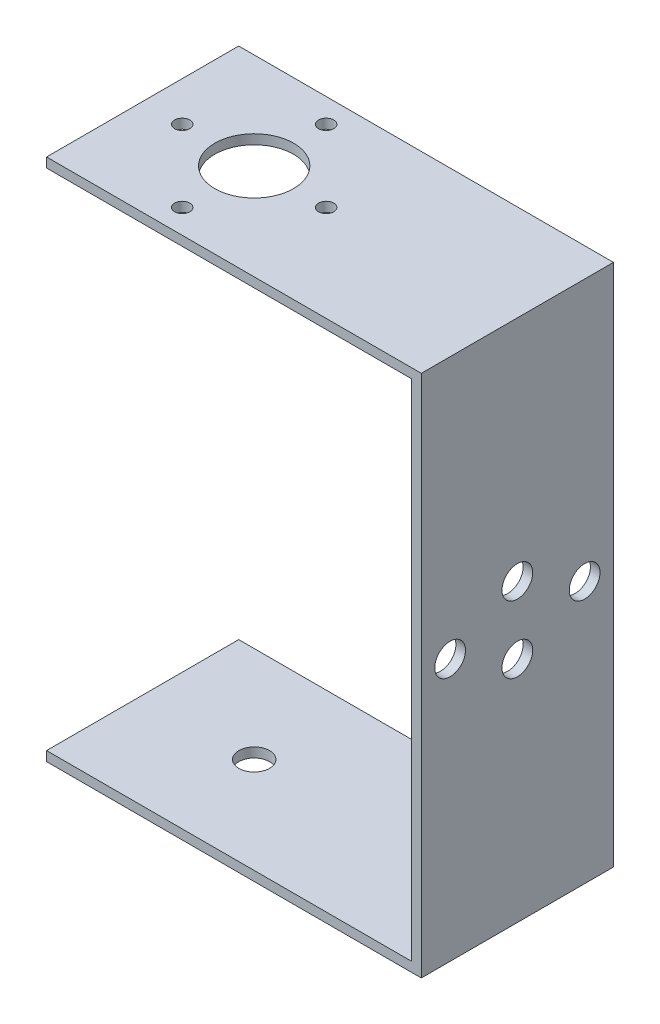
from build123d import *

# Parameters (mm, degrees)
SKETCH_1_W           = 20
SKETCH_1_H           = 54.5
EXTRUDE_1_DEPTH      = 1
SKETCH_2_W           = 20
SKETCH_2_H           = 1
EXTRUDE_2_DEPTH      = 38
SKETCH_3_W           = 20
SKETCH_3_H           = 1
EXTRUDE_3_DEPTH      = 38
SKETCH_4_R           = 4.1
CUT_EXTRUDE_1_DEPTH  = 1
SKETCH_5_R           = 0.79
CUT_EXTRUDE_2_DEPTH  = 1
SKETCH_6_R           = 0.79
CUT_EXTRUDE_3_DEPTH  = 1
SKETCH_7_R           = 0.79
CUT_EXTRUDE_4_DEPTH  = 1
SKETCH_8_R           = 0.79
CUT_EXTRUDE_5_DEPTH  = 1
SKETCH_9_R           = 1.6
CUT_EXTRUDE_6_DEPTH  = 1
CUT_EXTRUDE_7_REACH  = 71.937
SKETCH_10_R          = 1.6
CUT_EXTRUDE_8_REACH  = 71.937
SKETCH_11_R          = 1.6
CUT_EXTRUDE_9_REACH  = 71.937
SKETCH_12_R          = 1.6
CUT_EXTRUDE_10_REACH = 71.937
SKETCH_14_R          = 1.6


with BuildPart() as part:
    # ｽｹｯﾁ1 → ﾎﾞｽ - 押し出し1 (new body)
    with BuildSketch(Plane(origin=(0, 0, 0), x_dir=(0, 0, -1), z_dir=(1, 0, 0))):
        with Locations((10, 27.25)):
            Rectangle(SKETCH_1_W, SKETCH_1_H)
    extrude(amount=EXTRUDE_1_DEPTH)

    # ｽｹｯﾁ2 → ﾎﾞｽ - 押し出し2 (add)
    with BuildSketch(Plane.ZY):
        with Locations((-10, 54)):
            Rectangle(SKETCH_2_W, SKETCH_2_H)
    extrude(amount=EXTRUDE_2_DEPTH)

    # ｽｹｯﾁ3 → ﾎﾞｽ - 押し出し3 (add)
    with BuildSketch(Plane.ZY):
        with Locations((-10, 0.5)):
            Rectangle(SKETCH_3_W, SKETCH_3_H)
    extrude(amount=EXTRUDE_3_DEPTH)

    # ｽｹｯﾁ4 → ｶｯﾄ - 押し出し1 (cut)
    with BuildSketch(Plane(origin=(0, 54.5, 0), x_dir=(1, 0, 0), z_dir=(0, 1, 0))):
        with Locations((-26.39, 10)):
            Circle(SKETCH_4_R)
    extrude(amount=-CUT_EXTRUDE_1_DEPTH, mode=Mode.SUBTRACT)

    # ｽｹｯﾁ5 → ｶｯﾄ - 押し出し2 (cut)
    with BuildSketch(Plane(origin=(0, 54.5, 0), x_dir=(1, 0, 0), z_dir=(0, 1, 0))):
        with Locations((-33.88, 10)):
            Circle(SKETCH_5_R)
    extrude(amount=-CUT_EXTRUDE_2_DEPTH, mode=Mode.SUBTRACT)

    # ｽｹｯﾁ6 → ｶｯﾄ - 押し出し3 (cut)
    with BuildSketch(Plane(origin=(0, 54.5, 0), x_dir=(1, 0, 0), z_dir=(0, 1, 0))):
        with Locations((-18.9, 10)):
            Circle(SKETCH_6_R)
    extrude(amount=-CUT_EXTRUDE_3_DEPTH, mode=Mode.SUBTRACT)

    # ｽｹｯﾁ7 → ｶｯﾄ - 押し出し4 (cut)
    with BuildSketch(Plane(origin=(0, 54.5, 0), x_dir=(1, 0, 0), z_dir=(0, 1, 0))):
        with Locations((-26.39, 2.51)):
            Circle(SKETCH_7_R)
    extrude(amount=-CUT_EXTRUDE_4_DEPTH, mode=Mode.SUBTRACT)

    # ｽｹｯﾁ8 → ｶｯﾄ - 押し出し5 (cut)
    with BuildSketch(Plane(origin=(0, 54.5, 0), x_dir=(1, 0, 0), z_dir=(0, 1, 0))):
        with Locations((-26.39, 17.49)):
            Circle(SKETCH_8_R)
    extrude(amount=-CUT_EXTRUDE_5_DEPTH, mode=Mode.SUBTRACT)

    # ｽｹｯﾁ9 → ｶｯﾄ - 押し出し6 (cut)
    with BuildSketch(Plane(origin=(0, 0, 0), x_dir=(-1, 0, 0), z_dir=(0, -1, 0))):
        with Locations((26.39, 10)):
            Circle(SKETCH_9_R)
    extrude(amount=-CUT_EXTRUDE_6_DEPTH, mode=Mode.SUBTRACT)

    # ｽｹｯﾁ10 → ｶｯﾄ - 押し出し7 (cut, up to next)
    with BuildSketch(Plane(origin=(1, 0, 0), x_dir=(0, 0, -1), z_dir=(1, 0, 0)), mode=Mode.PRIVATE) as cut_extrude_7_sk1:
        with Locations((17, 27.25)):
            Circle(SKETCH_10_R)
    cut_extrude_7_tool1 = extrude(cut_extrude_7_sk1.sketch, amount=-CUT_EXTRUDE_7_REACH, mode=Mode.PRIVATE) & part.part
    add(cut_extrude_7_tool1.solids().sort_by_distance((1, 27.25, -17))[0], mode=Mode.SUBTRACT)

    # ｽｹｯﾁ11 → ｶｯﾄ - 押し出し8 (cut, up to next)
    with BuildSketch(Plane(origin=(1, 0, 0), x_dir=(0, 0, -1), z_dir=(1, 0, 0)), mode=Mode.PRIVATE) as cut_extrude_8_sk1:
        with Locations((3, 27.25)):
            Circle(SKETCH_11_R)
    cut_extrude_8_tool1 = extrude(cut_extrude_8_sk1.sketch, amount=-CUT_EXTRUDE_8_REACH, mode=Mode.PRIVATE) & part.part
    add(cut_extrude_8_tool1.solids().sort_by_distance((1, 27.25, -3))[0], mode=Mode.SUBTRACT)

    # ｽｹｯﾁ12 → ｶｯﾄ - 押し出し9 (cut, up to next)
    with BuildSketch(Plane(origin=(1, 0, 0), x_dir=(0, 0, -1), z_dir=(1, 0, 0)), mode=Mode.PRIVATE) as cut_extrude_9_sk1:
        with Locations((10, 23.75)):
            Circle(SKETCH_12_R)
    cut_extrude_9_tool1 = extrude(cut_extrude_9_sk1.sketch, amount=-CUT_EXTRUDE_9_REACH, mode=Mode.PRIVATE) & part.part
    add(cut_extrude_9_tool1.solids().sort_by_distance((1, 23.75, -10))[0], mode=Mode.SUBTRACT)

    # ｽｹｯﾁ14 → ｶｯﾄ - 押し出し10 (cut, up to next)
    with BuildSketch(Plane(origin=(1, 0, 0), x_dir=(0, 0, -1), z_dir=(1, 0, 0)), mode=Mode.PRIVATE) as cut_extrude_10_sk1:
        with Locations((10, 30.75)):
            Circle(SKETCH_14_R)
    cut_extrude_10_tool1 = extrude(cut_extrude_10_sk1.sketch, amount=-CUT_EXTRUDE_10_REACH, mode=Mode.PRIVATE) & part.part
    add(cut_extrude_10_tool1.solids().sort_by_distance((1, 30.75, -10))[0], mode=Mode.SUBTRACT)


solid = part.part
